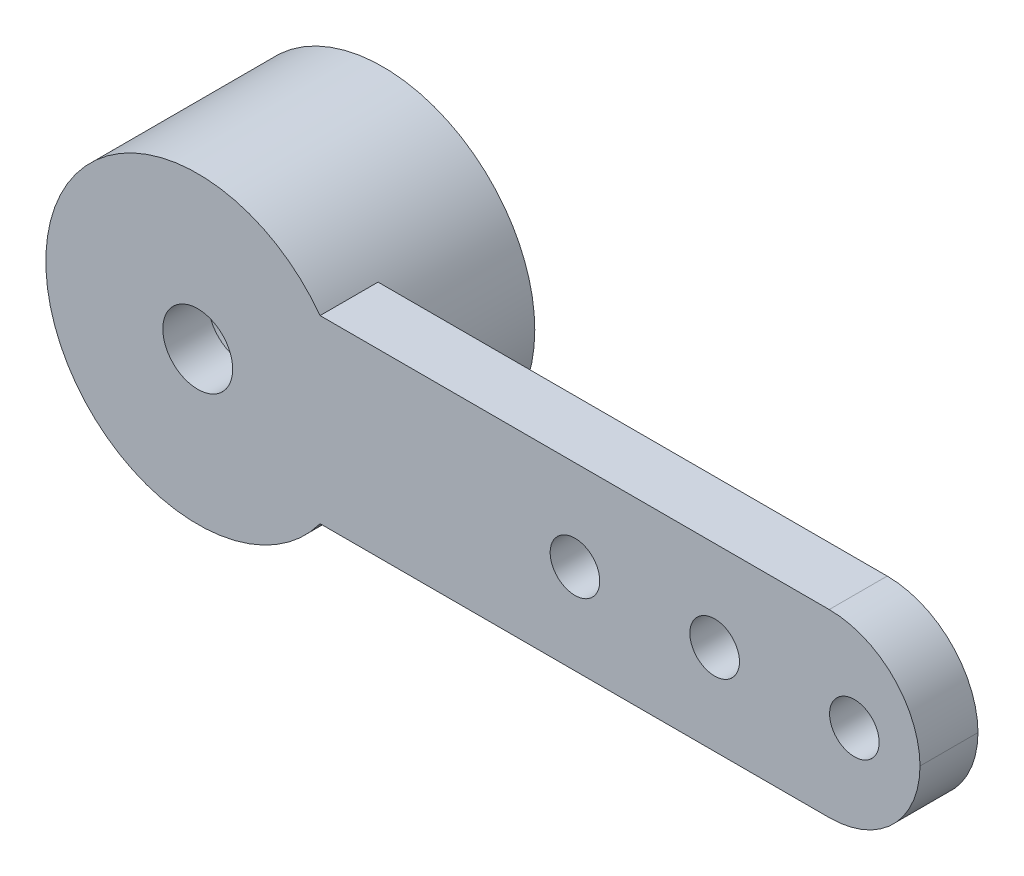
from build123d import *

# Parameters (mm, degrees)
SKETCH1_R           = 2.76225
BOSS_EXTRUDE1_DEPTH = 3.3655
SKETCH2_W           = 13.1318
SKETCH2_H           = 3.2766
BOSS_EXTRUDE2_DEPTH = 1.0541
FILLET1_R           = 1.651
SKETCH3_R           = 0.635
CUT_EXTRUDE1_DEPTH  = 3.3655
SKETCH4_R           = 1.49225
CUT_EXTRUDE2_DEPTH  = 2.54
SKETCH5_R           = 0.45085
CUT_EXTRUDE3_DEPTH  = 14.834720946


with BuildPart() as part:
    # Sketch1 → Boss-Extrude1 (new body)
    with BuildSketch(Plane.XY):
        Circle(SKETCH1_R)
    extrude(amount=BOSS_EXTRUDE1_DEPTH)

    # Sketch2 → Boss-Extrude2 (add)
    with BuildSketch(Plane.XY.offset(3.3655)):
        with Locations((6.5659, 0)):
            Rectangle(SKETCH2_W, SKETCH2_H)
    extrude(amount=-BOSS_EXTRUDE2_DEPTH)

    # Fillet1
    # the kernel refuses this fillet: 1.651 mm, written as the material it takes off along each edge
    with BuildSketch(Plane(origin=(13.1318, -1.6383, 7.493), x_dir=(-1, 0, 0), z_dir=(0, 0, -1))) as fillet1_piece_1:
        with BuildLine():
            CenterArc((FILLET1_R, FILLET1_R), FILLET1_R, 180, 90)
            Line((0, FILLET1_R), (0, 0))
            Line((0, 0), (FILLET1_R, 0))
        make_face()
    extrude(amount=9.3091, mode=Mode.SUBTRACT)
    with BuildSketch(Plane(origin=(13.1318, 1.6383, 7.493), x_dir=(-1, 0, 0), z_dir=(0, 0, -1))) as fillet1_piece_2:
        with BuildLine():
            CenterArc((FILLET1_R, -FILLET1_R), FILLET1_R, 90, 90)
            Line((0, -FILLET1_R), (0, 0))
            Line((0, 0), (FILLET1_R, 0))
        make_face()
    extrude(amount=9.3091, mode=Mode.SUBTRACT)

    # Sketch3 → Cut-Extrude1 (cut)
    with BuildSketch(Plane.XY.offset(3.3655)):
        Circle(SKETCH3_R)
    extrude(amount=-CUT_EXTRUDE1_DEPTH, mode=Mode.SUBTRACT)

    # Sketch4 → Cut-Extrude2 (cut)
    with BuildSketch(Plane(origin=(0, 0, 0), x_dir=(-1, 0, 0), z_dir=(0, 0, -1))):
        Circle(SKETCH4_R)
    extrude(amount=-CUT_EXTRUDE2_DEPTH, mode=Mode.SUBTRACT)

    # Sketch5 → Cut-Extrude3 (cut, through all)
    with BuildSketch(Plane.XY.offset(3.3655)):
        with Locations((6.858, 0)):
            Circle(SKETCH5_R)
        with Locations((9.398, 0)):
            Circle(SKETCH5_R)
        with Locations((11.938, 0)):
            Circle(SKETCH5_R)
    extrude(amount=-CUT_EXTRUDE3_DEPTH, mode=Mode.SUBTRACT)


solid = part.part
